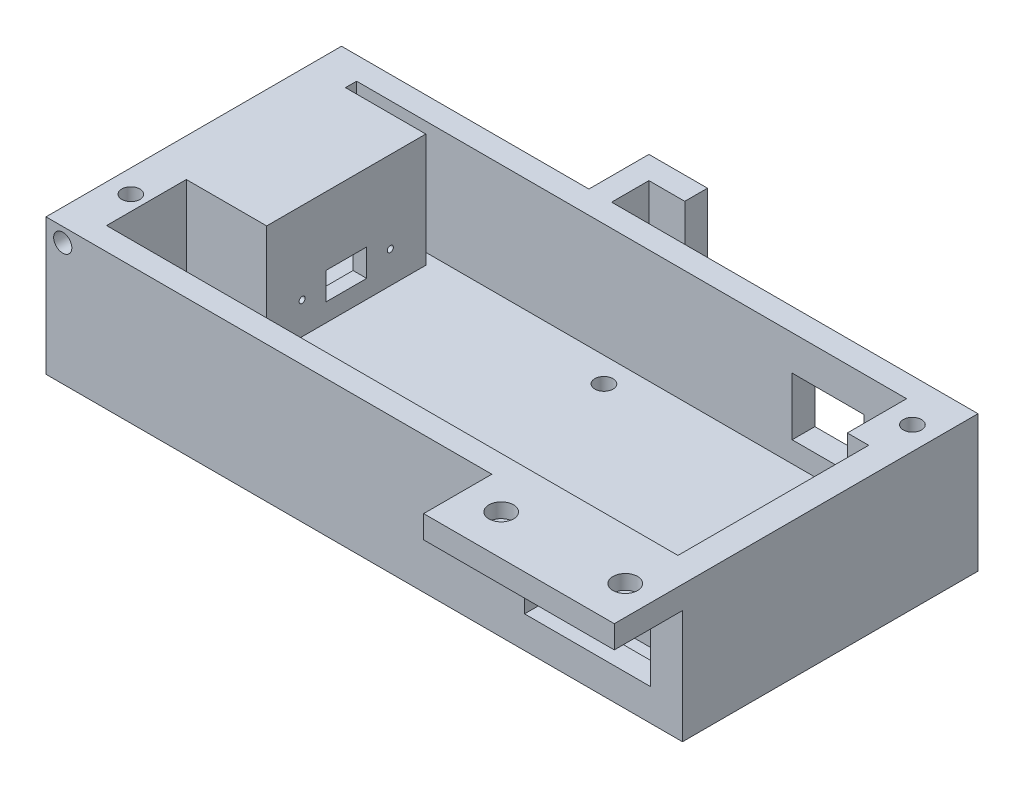
from build123d import *

# Parameters (mm, degrees)
SKETCH1_W            = 134
SKETCH1_H            = 55
BOSS_EXTRUDE1_DEPTH  = 5
BOSS_EXTRUDE2_DEPTH  = 14
SKETCH6_R            = 2
CUT_EXTRUDE2_DEPTH   = 16
BOSS_EXTRUDE4_DEPTH  = 10
SKETCH8_R            = 1.5
BOSS_EXTRUDE5_DEPTH  = 6
SKETCH9_W            = 9
SKETCH9_H            = 6
SKETCH9_R            = 0.666669423
CUT_EXTRUDE3_DEPTH   = 6
BOSS_EXTRUDE6_DEPTH  = 30
SKETCH11_W           = 26
SKETCH11_H           = 35
BOSS_EXTRUDE7_DEPTH  = 11
SKETCH12_R           = 2
CUT_EXTRUDE4_DEPTH   = 89.466034115
SKETCH13_W           = 29
SKETCH13_H           = 1
CUT_EXTRUDE5_DEPTH   = 23
BOSS_EXTRUDE8_DEPTH  = 12
SKETCH15_W           = 7.881166065
SKETCH15_H           = 6.31785274
BOSS_EXTRUDE9_DEPTH  = 8.206
SKETCH17_W           = 5
SKETCH17_H           = 42
BOSS_EXTRUDE10_DEPTH = 8.206
SKETCH18_W           = 27.737732315
SKETCH18_H           = 11
CUT_EXTRUDE6_DEPTH   = 5
SKETCH19_W           = 8.32170706
SKETCH19_H           = 17.542615134
SKETCH19_H_2         = 2.457384866
BOSS_EXTRUDE11_DEPTH = 25
SKETCH21_W           = 41.935962389
SKETCH21_H           = 5
BOSS_EXTRUDE12_DEPTH = 15
SKETCH22_R           = 2.7
CUT_EXTRUDE7_DEPTH   = 3.2
SKETCH23_R           = 1.5
CUT_EXTRUDE8_DEPTH   = 8.2
SKETCH24_R           = 2
CUT_EXTRUDE9_DEPTH   = 6.2
SKETCH25_R           = 2
CUT_EXTRUDE10_DEPTH  = 10.2
SKETCH26_W           = 4.703812025
SKETCH26_H           = 13.040944853
BOSS_EXTRUDE13_DEPTH = 25
SKETCH27_R           = 2
CUT_EXTRUDE11_DEPTH  = 11.2
SKETCH28_W           = 12.881166065
SKETCH28_H           = 42
BOSS_EXTRUDE14_DEPTH = 5
SKETCH29_R           = 1.5
CUT_EXTRUDE12_DEPTH  = 7
SKETCH30_R           = 2.75
CUT_EXTRUDE13_DEPTH  = 3
SKETCH31_W           = 15.85625148
SKETCH31_H           = 12.7
CUT_EXTRUDE14_DEPTH  = 8
FILLET1_R            = 10
FILLET2_R            = 10
FILLET3_R            = 10


with BuildPart() as part:
    # Sketch1 → Boss-Extrude1 (new body)
    with BuildSketch(Plane(origin=(0, 0, 0), x_dir=(1, 0, 0), z_dir=(0, 1, 0))):
        with Locations((-6.326180258, -10.214288954)):
            Rectangle(SKETCH1_W, SKETCH1_H)
    extrude(amount=BOSS_EXTRUDE1_DEPTH)

    # Sketch2 → Boss-Extrude2 (add)
    with BuildSketch(Plane(origin=(0, 5, 0), x_dir=(1, 0, 0), z_dir=(0, 1, 0))):
        Polygon((-73.326180258, 14.82832618), (-73.326180258, 11.82832618), (-50.326180258, 11.82832618), (-50.326180258, -17.17167382), (-73.326180258, -17.17167382), (-73.326180258, -20.17167382), (-47.326180258, -20.17167382), (-47.326180258, 14.82832618), align=None)
    extrude(amount=BOSS_EXTRUDE2_DEPTH)

    # Sketch6 → Cut-Extrude2 (cut)
    with BuildSketch(Plane(origin=(0, 5, 0), x_dir=(1, 0, 0), z_dir=(0, 1, 0))):
        with Locations(Location((-5.143804301, 11.824371315, 0), (0, 0, 270))):
            Circle(SKETCH6_R)
    extrude(amount=-CUT_EXTRUDE2_DEPTH, mode=Mode.SUBTRACT)

    # Sketch7 → Boss-Extrude4 (add)
    with BuildSketch(Plane(origin=(0, 5, 0), x_dir=(1, 0, 0), z_dir=(0, 1, 0))):
        Polygon((-9.572595602, -29.175628685), (12.857306, -29.175628685), (50.427404398, -29.175628685), (50.427404398, -33.25833673), (-9.572595602, -33.25833673), align=None)
    extrude(amount=BOSS_EXTRUDE4_DEPTH)

    # Sketch8 → Boss-Extrude5 (add)
    with BuildSketch(Plane(origin=(0, 5, 0), x_dir=(1, 0, 0), z_dir=(0, 1, 0))):
        with Locations(Location((46.72611237, 11.824371315, 0), (0, 0, 270))):
            Circle(SKETCH8_R)
    extrude(amount=BOSS_EXTRUDE5_DEPTH)

    # Sketch9 → Cut-Extrude3 (cut)
    with BuildSketch(Plane.ZY.offset(50.326180258)):
        with Locations((2.67167382, 12)):
            Rectangle(SKETCH9_W, SKETCH9_H)
        with Locations((-7.02832618, 12)):
            Circle(SKETCH9_R)
        with Locations((12.37167382, 12)):
            Circle(SKETCH9_R)
    extrude(amount=-CUT_EXTRUDE3_DEPTH, mode=Mode.SUBTRACT)

    # Sketch10 → Boss-Extrude6 (add)
    with BuildSketch(Plane(origin=(0, 0, 0), x_dir=(1, 0, 0), z_dir=(0, 1, 0))):
        Polygon((-73.326180258, 17.285711046), (-73.326180258, 22.285711046), (66.673819742, 22.285711046), (66.673819742, -42.714288954), (-73.326180258, -42.714288954), (-73.326180258, -37.714288954), (60.673819742, -37.714288954), (60.673819742, 17.285711046), align=None)
    extrude(amount=BOSS_EXTRUDE6_DEPTH)

    # Sketch11 → Boss-Extrude7 (add)
    with BuildSketch(Plane(origin=(0, 19, 0), x_dir=(1, 0, 0), z_dir=(0, 1, 0))):
        with Locations((-60.326180258, -2.67167382)):
            Rectangle(SKETCH11_W, SKETCH11_H)
    extrude(amount=BOSS_EXTRUDE7_DEPTH)

    # Sketch12 → Cut-Extrude4 (cut, through all)
    with BuildSketch(Plane(origin=(0, 5, 0), x_dir=(1, 0, 0), z_dir=(0, 1, 0))):
        with Locations(Location((-40.868568225, -32.116513497, 0), (0, 0, 270))):
            Circle(SKETCH12_R)
        with Locations(Location((-23.868568225, -32.116530453, 0), (0, 0, 270))):
            Circle(SKETCH12_R)
    extrude(amount=-CUT_EXTRUDE4_DEPTH, mode=Mode.SUBTRACT)

    # Sketch13 → Cut-Extrude5 (cut)
    with BuildSketch(Plane.ZY.offset(73.326180258)):
        with Locations((2.67167382, 19.5)):
            Rectangle(SKETCH13_W, SKETCH13_H)
    extrude(amount=-CUT_EXTRUDE5_DEPTH, mode=Mode.SUBTRACT)

    # Sketch14 → Boss-Extrude8 (add)
    with BuildSketch(Plane.XZ):
        Polygon((-13.914425371, -22.285711046), (46.65185498, -22.285711046), (46.65185498, -17.285711046), (-13.914425371, -17.285711046), (-18.914425371, -17.285711046), (-18.914425371, -22.285711046), align=None)
    extrude(amount=BOSS_EXTRUDE8_DEPTH)

    # Sketch15 → Boss-Extrude9 (add)
    with BuildSketch(Plane(origin=(0, 0, -22.285711046), x_dir=(-1, 0, 0), z_dir=(0, 0, -1))):
        with Locations((9.973842339, -8.84107363)):
            Rectangle(SKETCH15_W, SKETCH15_H)
    extrude(amount=BOSS_EXTRUDE9_DEPTH)

    # Sketch17 → Boss-Extrude10 (add)
    with BuildSketch(Plane(origin=(0, 0, -22.285711046), x_dir=(-1, 0, 0), z_dir=(0, 0, -1))):
        with Locations((16.414425371, 9)):
            Rectangle(SKETCH17_W, SKETCH17_H)
    extrude(amount=BOSS_EXTRUDE10_DEPTH)

    # Sketch18 → Cut-Extrude6 (cut)
    with BuildSketch(Plane.XY.offset(42.714288954)):
        with Locations((45.804953585, 12.5)):
            Rectangle(SKETCH18_W, SKETCH18_H)
    extrude(amount=-CUT_EXTRUDE6_DEPTH, mode=Mode.SUBTRACT)

    # Sketch19 → Boss-Extrude11 (add)
    with BuildSketch(Plane(origin=(0, 5, 0), x_dir=(1, 0, 0), z_dir=(0, 1, 0))):
        with Locations((-69.165326728, -28.942981387)):
            Rectangle(SKETCH19_W, SKETCH19_H)
        with Locations((-69.165326728, 16.057018613)):
            Rectangle(SKETCH19_W, SKETCH19_H_2)
    extrude(amount=BOSS_EXTRUDE11_DEPTH)

    # Sketch21 → Boss-Extrude12 (add)
    with BuildSketch(Plane.XY.offset(42.714288954)):
        with Locations((45.705838548, 27.5)):
            Rectangle(SKETCH21_W, SKETCH21_H)
    extrude(amount=BOSS_EXTRUDE12_DEPTH)

    # Sketch22 → Cut-Extrude7 (cut)
    with BuildSketch(Plane(origin=(0, 30, 0), x_dir=(1, 0, 0), z_dir=(0, 1, 0))):
        with Locations(Location((32.939337155, -48.85061207, 0), (0, 0, 270))):
            Circle(SKETCH22_R)
        with Locations(Location((60.22852181, -48.85061207, 0), (0, 0, 270))):
            Circle(SKETCH22_R)
    extrude(amount=-CUT_EXTRUDE7_DEPTH, mode=Mode.SUBTRACT)

    # Sketch23 → Cut-Extrude8 (cut)
    with BuildSketch(Plane(origin=(0, 30, 0), x_dir=(1, 0, 0), z_dir=(0, 1, 0))):
        with Locations(Location((60.22852181, -48.85061207, 0), (0, 0, 270))):
            Circle(SKETCH23_R)
        with Locations(Location((32.939337155, -48.85061207, 0), (0, 0, 270))):
            Circle(SKETCH23_R)
    extrude(amount=-CUT_EXTRUDE8_DEPTH, mode=Mode.SUBTRACT)

    # Sketch24 → Cut-Extrude9 (cut)
    with BuildSketch(Plane.XY.offset(42.714288954)):
        with Locations((-69.643270331, 26.922023127)):
            Circle(SKETCH24_R)
    extrude(amount=-CUT_EXTRUDE9_DEPTH, mode=Mode.SUBTRACT)

    # Sketch25 → Cut-Extrude10 (cut)
    with BuildSketch(Plane(origin=(0, 30, 0), x_dir=(1, 0, 0), z_dir=(0, 1, 0))):
        with Locations(Location((-68.301285916, -29.073958674, 0), (0, 0, 270))):
            Circle(SKETCH25_R)
    extrude(amount=-CUT_EXTRUDE10_DEPTH, mode=Mode.SUBTRACT)

    # Sketch26 → Boss-Extrude13 (add)
    with BuildSketch(Plane(origin=(0, 5, 0), x_dir=(1, 0, 0), z_dir=(0, 1, 0))):
        with Locations((58.32191373, 10.765238619)):
            Rectangle(SKETCH26_W, SKETCH26_H)
    extrude(amount=BOSS_EXTRUDE13_DEPTH)

    # Sketch27 → Cut-Extrude11 (cut)
    with BuildSketch(Plane(origin=(0, 30, 0), x_dir=(1, 0, 0), z_dir=(0, 1, 0))):
        with Locations(Location((61.565901952, 12.965958555, 0), (0, 0, 270))):
            Circle(SKETCH27_R)
    extrude(amount=-CUT_EXTRUDE11_DEPTH, mode=Mode.SUBTRACT)

    # Sketch28 → Boss-Extrude14 (add)
    with BuildSketch(Plane(origin=(0, 0, -30.491711046), x_dir=(-1, 0, 0), z_dir=(0, 0, -1))):
        with Locations((12.473842339, 9)):
            Rectangle(SKETCH28_W, SKETCH28_H)
    extrude(amount=BOSS_EXTRUDE14_DEPTH)

    # Sketch29 → Cut-Extrude12 (cut)
    with BuildSketch(Plane(origin=(0, -5.68214726, 0), x_dir=(1, 0, 0), z_dir=(0, 1, 0))):
        with Locations(Location((-9.973842338, 26.388711046, 0), (0, 0, 270))):
            Circle(SKETCH29_R)
    extrude(amount=-CUT_EXTRUDE12_DEPTH, mode=Mode.SUBTRACT)

    # Sketch30 → Cut-Extrude13 (cut)
    with BuildSketch(Plane.XZ.offset(12)):
        with Locations(Location((-9.973842338, -26.388711046, 0), (0, 0, 270))):
            Circle(SKETCH30_R)
    extrude(amount=-CUT_EXTRUDE13_DEPTH, mode=Mode.SUBTRACT)

    # Sketch31 → Cut-Extrude14 (cut)
    with BuildSketch(Plane(origin=(0, 0, -22.285711046), x_dir=(-1, 0, 0), z_dir=(0, 0, -1))):
        with Locations((-38.72372924, 15.943526368)):
            Rectangle(SKETCH31_W, SKETCH31_H)
    extrude(amount=-CUT_EXTRUDE14_DEPTH, mode=Mode.SUBTRACT)

    # Fillet1
    # the kernel refuses this fillet: 10 mm, written as the material it adds along each edge
    with BuildSketch(Plane(origin=(46.65185498, 0, -17.285711046), x_dir=(0, 0, 1), z_dir=(-1, 0, 0))) as fillet1_piece_1_section:
        with BuildLine():
            CenterArc((FILLET1_R, -FILLET1_R), FILLET1_R, 90, 90)
            Line((0, -FILLET1_R), (0, 0))
            Line((0, 0), (FILLET1_R, 0))
        make_face()
    fillet1_piece_1 = extrude(amount=65.56628035, mode=Mode.PRIVATE)
    fillet1_piece_1 = fillet1_piece_1 - Plane(origin=(-5.143804301, -2.281344891, -11.824371315), x_dir=(0, 0, 1), z_dir=(0, 1, 0)) * Cylinder(2, 172, mode=Mode.PRIVATE)
    add(fillet1_piece_1)

    # Fillet2
    fillet2_edges = [part.edges().sort_by_distance(p)[0] for p in [
        (-18.914425371, 0, -14.785711046),
    ]]
    fillet(fillet2_edges, radius=FILLET2_R)

    # Fillet3
    fillet3_edges = [part.edges().sort_by_distance(p)[0] for p in [
        (46.65185498, 0, -14.785711046),
    ]]
    fillet(fillet3_edges, radius=FILLET3_R)


solid = part.part
